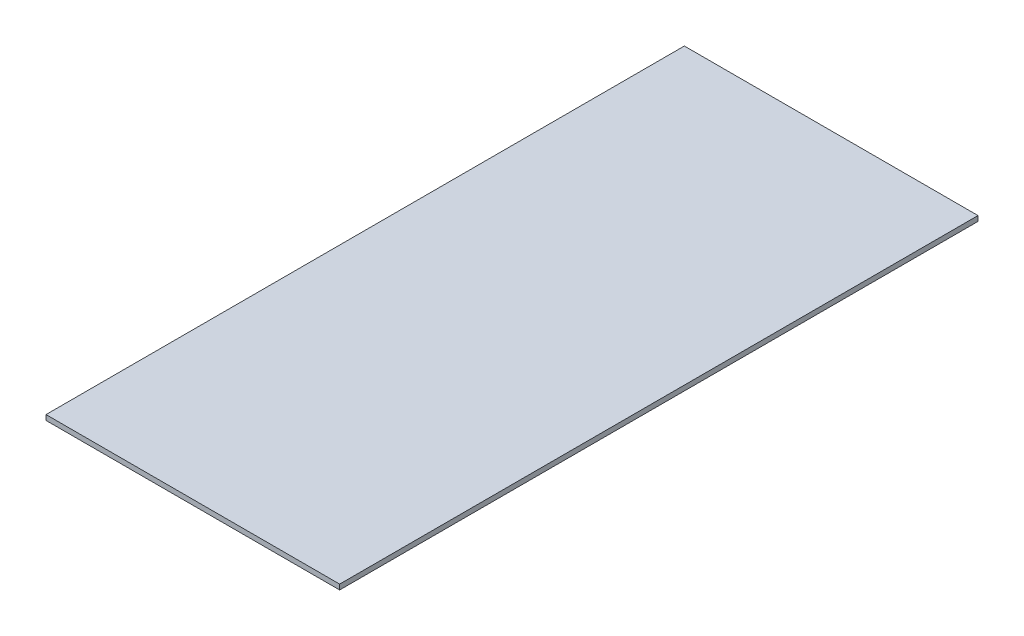
from build123d import *

# Parameters (mm, degrees)
SKETCH1_W           = 460
SKETCH1_H           = 1000
BOSS_EXTRUDE1_DEPTH = 4


with BuildPart() as part:
    # Sketch1 → Boss-Extrude1 (new, symmetric)
    with BuildSketch(Plane(origin=(0, 0, 0), x_dir=(1, 0, 0), z_dir=(0, 1, 0))):
        Rectangle(SKETCH1_W, SKETCH1_H)
    extrude(amount=BOSS_EXTRUDE1_DEPTH, both=True)


solid = part.part
